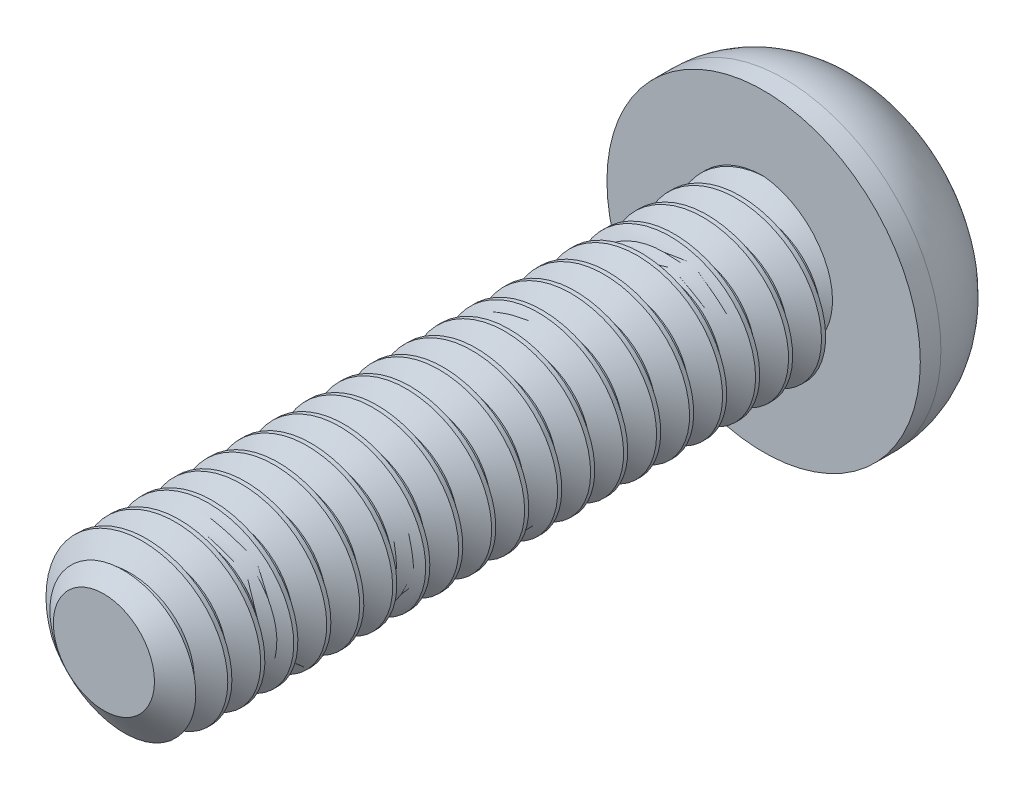
from build123d import *

# Parameters (mm, degrees)
SKETCH1_R          = 2
EXTRUDE1_DEPTH     = 16
CUT_SWEEP1_PITCH   = 0.8
SKETCH6_R          = 3.8
EXTRUDE2_DEPTH     = 2.75
CUT_EXTRUDE1_DEPTH = 2.25
SKETCH8_R          = 1.732050808
CUT_EXTRUDE2_DEPTH = 20.504935408
CUT_EXTRUDE2_TAPER = 45


with BuildPart() as part:
    # Sketch1 → Extrude1 (new body)
    with BuildSketch(Plane.XY):
        Circle(SKETCH1_R)
    extrude(amount=-EXTRUDE1_DEPTH)

    # Cut-Sweep1: arcs per turn and ends read off the stored shape
    # Cut-Sweep1: the profile of Sketch3 profile screwed along a right-hand helix through 23 turns, 6 arcs to a turn; built about Z, then put on its axis
    cut_sweep1_z = Axis((0, 0, 0), (0, 0, 1))
    cut_sweep1_corners = [(2.0003, 0, -1.500173205), (1.480384758, 0, -1.2), (1.480384758, 0, -1.1), (2.0003, 0, -0.799826795)]
    with BuildLine(mode=Mode.PRIVATE) as cut_sweep1_profile:
        Line(cut_sweep1_corners[0], cut_sweep1_corners[1])
        Line(cut_sweep1_corners[1], cut_sweep1_corners[2])
        Line(cut_sweep1_corners[2], cut_sweep1_corners[3])
        Line(cut_sweep1_corners[3], cut_sweep1_corners[0])
    cut_sweep1_cap = Face(cut_sweep1_profile.wire())
    cut_sweep1_turn_angles = [0, 30, 60, 90, 120, 150, 180, 210, 240, 270, 300, 330, 360]
    cut_sweep1_turn_weights = [1, 0.8660254037844387, 1, 0.8660254037844387, 1, 0.8660254037844387, 1, 0.8660254037844387, 1, 0.8660254037844387, 1, 0.8660254037844387, 1]
    cut_sweep1_turn_rails = [Edge.make_bspline([Vector(p[0], p[1], 0).rotate(cut_sweep1_z, cut_sweep1_turn_angles[k]) / cut_sweep1_turn_weights[k] + Vector(0, 0, p[2] + CUT_SWEEP1_PITCH * cut_sweep1_turn_angles[k] / 360) for k in range(13)], [0, 0, 0, 1, 1, 2, 2, 3, 3, 4, 4, 5, 5, 6, 6, 6], 2, cut_sweep1_turn_weights) for p in cut_sweep1_corners]
    cut_sweep1_turn_sides = [Face.make_surface_from_curves(cut_sweep1_turn_rails[p[0]], cut_sweep1_turn_rails[p[1]]) for p in [(0, 1), (1, 2), (2, 3), (3, 0)]]
    cut_sweep1 = Plane(origin=(0, 0, 0), x_dir=(0, 1, 0), z_dir=(0, 0, -1)) * Solid(Shell([*[p.moved(Location((0, 0, CUT_SWEEP1_PITCH * i))) for i in range(23) for p in cut_sweep1_turn_sides], cut_sweep1_cap, cut_sweep1_cap.rotate(cut_sweep1_z, 8280).moved(Location((0, 0, CUT_SWEEP1_PITCH * 8280 / 360)))]))
    add(cut_sweep1, mode=Mode.SUBTRACT)

    # Sketch4 → Cut-Revolve1 (revolve, cut)
    with BuildSketch(Plane(origin=(0, 0, 0), x_dir=(0, 0, -1), z_dir=(1, 0, 0)), mode=Mode.PRIVATE) as cut_revolve1_sk:
        Polygon((0.541691224, 2), (0, 1.226384758), (0, 2), align=None)
    revolve(cut_revolve1_sk.sketch.rotate(Axis((0, 0, 0), (0, 0, -1)), 260.438603256), axis=Axis((0, 0, 0), (0, 0, -1)), mode=Mode.SUBTRACT)

    # Sketch6 → Extrude2 (add)
    with BuildSketch(Plane(origin=(0, 0, -16), x_dir=(-1, 0, 0), z_dir=(0, 0, -1))):
        Circle(SKETCH6_R)
    extrude(amount=EXTRUDE2_DEPTH)

    # Sketch10 → Cut-Revolve2 (revolve, cut)
    with BuildSketch(Plane(origin=(0, 0, 0), x_dir=(0, 0, -1), z_dir=(1, 0, 0)), mode=Mode.PRIVATE) as cut_revolve2_sk:
        with BuildLine():
            Line((16.5, 3.8), (16.5, 4.3))
            Line((16.5, 4.3), (19.25, 4.3))
            Line((19.25, 4.3), (19.25, 1.5))
            Line((19.25, 1.5), (18.75, 1.5))
            ThreePointArc((18.75, 1.5), (18.093959833, 3.108765054), (16.5, 3.8))
        make_face()
    revolve(cut_revolve2_sk.sketch.rotate(Axis((0, 0, 0), (0, 0, -1)), 90), axis=Axis((0, 0, 0), (0, 0, -1)), mode=Mode.SUBTRACT)

    # Sketch7 → Cut-Extrude1 (cut)
    with BuildSketch(Plane(origin=(0, 0, -18.75), x_dir=(-1, 0, 0), z_dir=(0, 0, -1))):
        Polygon((0, 1.732050808), (-1.5, 0.866025404), (-1.5, -0.866025404), (0, -1.732050808), (1.5, -0.866025404), (1.5, 0.866025404), align=None)
    extrude(amount=-CUT_EXTRUDE1_DEPTH, mode=Mode.SUBTRACT)

    # Sketch8 → Cut-Extrude2 (cut, through all)
    with BuildSketch(Plane.XY.offset(-18.75)):
        Circle(SKETCH8_R)
    extrude(amount=CUT_EXTRUDE2_DEPTH, taper=CUT_EXTRUDE2_TAPER, mode=Mode.SUBTRACT)


solid = part.part
